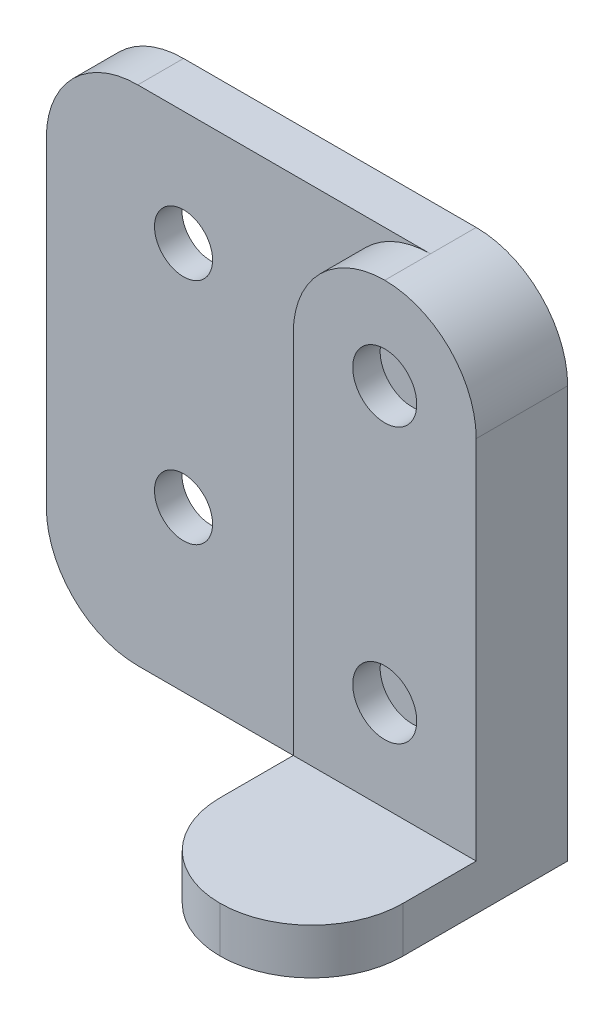
from build123d import *

# Parameters (mm, degrees)
SKETCH1_W           = 30
SKETCH1_H           = 50
BOSS_EXTRUDE1_DEPTH = 5
SKETCH5_R           = 3.175
CUT_EXTRUDE2_DEPTH  = 30.580398915
SKETCH2_W           = 5
SKETCH2_H           = 50
BOSS_EXTRUDE2_DEPTH = 2
SKETCH3_W           = 10
SKETCH3_H           = 50
BOSS_EXTRUDE3_DEPTH = 20
SKETCH4_R           = 3.5
CUT_EXTRUDE1_DEPTH  = 3
SKETCH6_R           = 9
CUT_EXTRUDE3_DEPTH  = 2
SKETCH7_W           = 32
SKETCH7_H           = 5
SKETCH7_W_2         = 20
SKETCH7_H_2         = 18
BOSS_EXTRUDE4_DEPTH = 5
FILLET1_R           = 10


with BuildPart() as part:
    # Sketch1 → Boss-Extrude1 (new body)
    with BuildSketch(Plane.XY):
        Rectangle(SKETCH1_W, SKETCH1_H)
    extrude(amount=BOSS_EXTRUDE1_DEPTH)

    # Sketch5 → Cut-Extrude2 (cut, through all)
    with BuildSketch(Plane.XY.offset(5)):
        with Locations((0, 12.5)):
            Circle(SKETCH5_R)
        with Locations((0, -12.5)):
            Circle(SKETCH5_R)
    extrude(amount=-CUT_EXTRUDE2_DEPTH, mode=Mode.SUBTRACT)

    # Sketch2 → Boss-Extrude2 (add)
    with BuildSketch(Plane(origin=(15, 0, 0), x_dir=(0, 0, -1), z_dir=(1, 0, 0))):
        with Locations((-2.5, 0)):
            Rectangle(SKETCH2_W, SKETCH2_H)
    extrude(amount=BOSS_EXTRUDE2_DEPTH)

    # Sketch3 → Boss-Extrude3 (add)
    with BuildSketch(Plane(origin=(17, 0, 0), x_dir=(0, 0, -1), z_dir=(1, 0, 0))):
        with Locations((-5, 0)):
            Rectangle(SKETCH3_W, SKETCH3_H)
    extrude(amount=BOSS_EXTRUDE3_DEPTH)

    # Sketch4 → Cut-Extrude1 (cut)
    with BuildSketch(Plane.XY.offset(10)):
        with Locations((27, 15)):
            Circle(SKETCH4_R)
        with Locations((27, -15)):
            Circle(SKETCH4_R)
    extrude(amount=-CUT_EXTRUDE1_DEPTH, mode=Mode.SUBTRACT)

    # Sketch6 → Cut-Extrude3 (cut)
    with BuildSketch(Plane(origin=(0, 0, 0), x_dir=(-1, 0, 0), z_dir=(0, 0, -1))):
        with Locations((0, 12.5)):
            Circle(SKETCH6_R)
        with Locations((0, -12.5)):
            Circle(SKETCH6_R)
    extrude(amount=-CUT_EXTRUDE3_DEPTH, mode=Mode.SUBTRACT)

    # Sketch7 → Boss-Extrude4 (add)
    with BuildSketch(Plane.XZ.offset(25)):
        with Locations((1, 2.5)):
            Rectangle(SKETCH7_W, SKETCH7_H)
        Polygon((17, 0), (37, 0), (37, 10), (17, 10), (17, 5), align=None)
        with Locations((27, 19)):
            Rectangle(SKETCH7_W_2, SKETCH7_H_2)
    extrude(amount=BOSS_EXTRUDE4_DEPTH)

    # Fillet1
    # the kernel refuses this fillet: 10 mm, written as the material it takes off along each edge
    with BuildSketch(Plane(origin=(17, 25, 5), x_dir=(0, -1, 0), z_dir=(0, 0, 1))) as fillet1_piece_1:
        with BuildLine():
            CenterArc((FILLET1_R, FILLET1_R), FILLET1_R, 180, 90)
            Line((0, FILLET1_R), (0, 0))
            Line((0, 0), (FILLET1_R, 0))
        make_face()
    extrude(amount=30, mode=Mode.SUBTRACT)
    with BuildSketch(Plane(origin=(37, 25, -25), x_dir=(0, -1, 0), z_dir=(0, 0, 1))) as fillet1_piece_2:
        with BuildLine():
            CenterArc((FILLET1_R, -FILLET1_R), FILLET1_R, 90, 90)
            Line((0, -FILLET1_R), (0, 0))
            Line((0, 0), (FILLET1_R, 0))
        make_face()
    extrude(amount=60, mode=Mode.SUBTRACT)
    with BuildSketch(Plane(origin=(37, 0, 28), x_dir=(0, 0, -1), z_dir=(0, -1, 0)), Plane(origin=(17, 0, 28), x_dir=(1, 0, 0), z_dir=(0, -1, 0))) as fillet1_piece_3:
        with BuildLine():
            CenterArc((FILLET1_R, -FILLET1_R), FILLET1_R, 90, 90)
            Line((0, -FILLET1_R), (0, 0))
            Line((0, 0), (FILLET1_R, 0))
        make_face()
    extrude(amount=55, mode=Mode.SUBTRACT)
    with BuildSketch(Plane(origin=(-15, -30, 30), x_dir=(0, 1, 0), z_dir=(0, 0, -1)), Plane(origin=(-15, 25, -25), x_dir=(0, -1, 0), z_dir=(0, 0, 1))) as fillet1_piece_4:
        with BuildLine():
            CenterArc((FILLET1_R, FILLET1_R), FILLET1_R, 180, 90)
            Line((0, FILLET1_R), (0, 0))
            Line((0, 0), (FILLET1_R, 0))
        make_face()
    extrude(amount=55, mode=Mode.SUBTRACT)


solid = part.part
